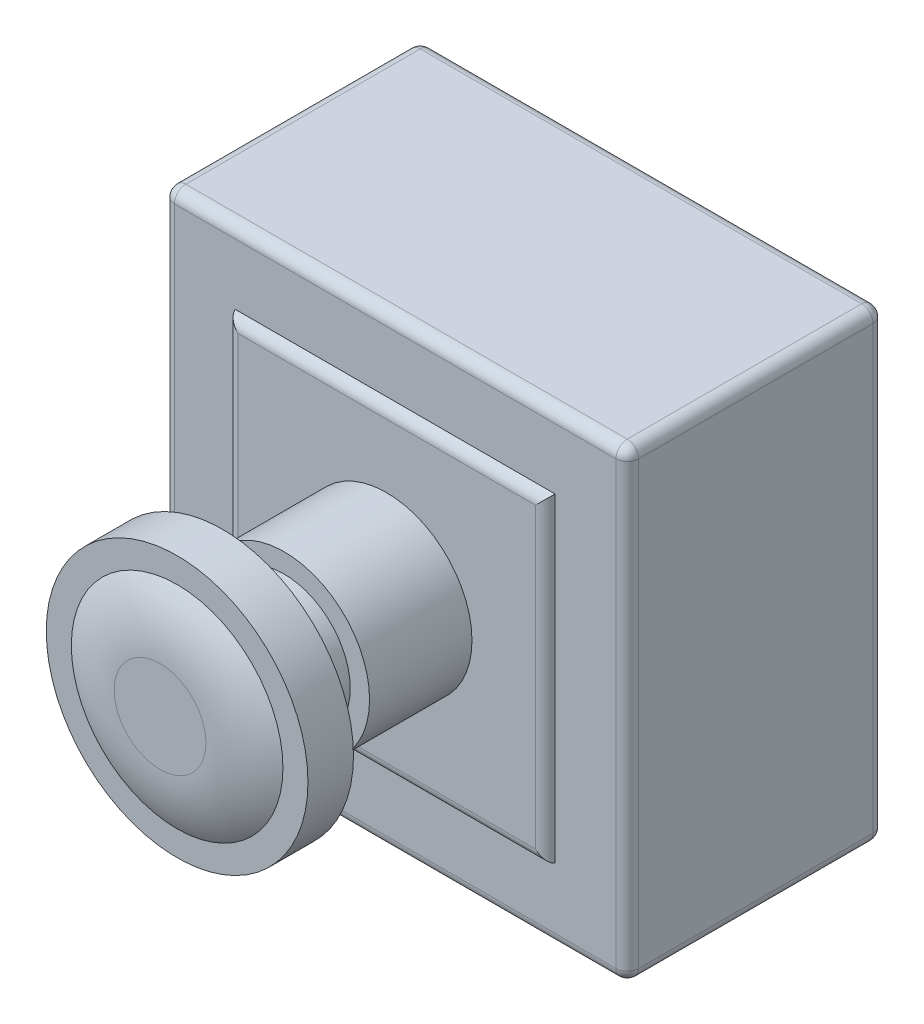
from build123d import *

# Parameters (mm, degrees)
CROQUIS1_W              = 40.8
CROQUIS1_H              = 40.8
SALIENTE_EXTRUIR1_DEPTH = 11.3
CROQUIS2_W              = 28.1
CROQUIS2_H              = 28.1
SALIENTE_EXTRUIR2_DEPTH = 0.75
REDONDEO1_R             = 1
CROQUIS3_R              = 7.5
SALIENTE_EXTRUIR3_DEPTH = 9
CROQUIS4_R              = 5.8
SALIENTE_EXTRUIR4_DEPTH = 7
CROQUIS5_R              = 11.5
SALIENTE_EXTRUIR5_DEPTH = 2
CROQUIS6_R              = 9.3
SALIENTE_EXTRUIR6_DEPTH = 1.5
REDONDEO4_R             = 10
CROQUIS7_R              = 2.5
SALIENTE_EXTRUIR7_DEPTH = 5
REDONDEO5_R             = 1


with BuildPart() as part:
    # Croquis1 → Saliente-Extruir1 (new, symmetric)
    with BuildSketch(Plane.XY):
        Rectangle(CROQUIS1_W, CROQUIS1_H)
    extrude(amount=SALIENTE_EXTRUIR1_DEPTH, both=True)

    # Croquis2 → Saliente-Extruir2 (add, symmetric)
    with BuildSketch(Plane.XY.offset(11.3)):
        Rectangle(CROQUIS2_W, CROQUIS2_H)
    extrude(amount=SALIENTE_EXTRUIR2_DEPTH, both=True)

    # Redondeo1
    # the kernel refuses this fillet: 1 mm, written as the material it takes off along each edge
    with BuildSketch(Plane(origin=(14.05, 16.470614591, 12.05), x_dir=(0, 0, -1), z_dir=(0, -1, 0)), Plane(origin=(-16.470614591, 14.05, 12.05), x_dir=(0, 0, -1), z_dir=(1, 0, 0)), Plane(origin=(16.470614591, -14.05, 12.05), x_dir=(0, 0, -1), z_dir=(-1, 0, 0)), Plane(origin=(-14.05, -16.470614591, 12.05), x_dir=(0, 0, -1), z_dir=(0, 1, 0))) as redondeo1_piece_1:
        with BuildLine():
            CenterArc((1, -0.968245837), REDONDEO1_R, 104.477512186, 75.522487814)
            Line((0, -0.968245837), (-0.02, -0.968245837))
            Line((-0.02, -0.968245837), (-0.02, 0))
            Line((-0.02, 0), (0, 0.02))
            ThreePointArc((0, 0.02), (0.375, 0.02), (0.745, 0.019364917))
            Line((0.745, 0.019364917), (0.75, 0))
        make_face()
    extrude(amount=32.941229183, mode=Mode.SUBTRACT)

    # Croquis3 → Saliente-Extruir3 (add)
    with BuildSketch(Plane.XY.offset(12.05)):
        Circle(CROQUIS3_R)
    extrude(amount=SALIENTE_EXTRUIR3_DEPTH)

    # Croquis4 → Saliente-Extruir4 (add)
    with BuildSketch(Plane.XY.offset(21.05)):
        Circle(CROQUIS4_R)
    extrude(amount=SALIENTE_EXTRUIR4_DEPTH)

    # Croquis5 → Saliente-Extruir5 (add, symmetric)
    with BuildSketch(Plane.XY.offset(28.05)):
        with Locations((-0.414239482, 0)):
            Circle(CROQUIS5_R)
    extrude(amount=SALIENTE_EXTRUIR5_DEPTH, both=True)

    # Croquis6 → Saliente-Extruir6 (add, symmetric)
    with BuildSketch(Plane.XY.offset(30.05)):
        with Locations((-0.414239482, 0)):
            Circle(CROQUIS6_R)
    extrude(amount=SALIENTE_EXTRUIR6_DEPTH, both=True)

    # Redondeo4
    # the kernel refuses this fillet: 10 mm, written as the material it takes off along each edge
    with BuildSketch(Plane(origin=(-0.414239482, 0, 31.55), x_dir=(1, 0, 0), z_dir=(0, -1, 0))) as redondeo4_piece_1:
        with BuildLine():
            CenterArc((4.032173124, -10), REDONDEO4_R, 58.211669383, 31.788330617)
            Line((4.032173124, 0), (4.032173124, 0.2))
            Line((4.032173124, 0.2), (9.3, 0.2))
            Line((9.3, 0.2), (9.5, 0))
            ThreePointArc((9.5, 0), (9.5, -0.75), (9.405356538, -1.33))
            Line((9.405356538, -1.33), (9.3, -1.5))
        make_face()
    revolve(axis=Axis((-0.414239482, 0, 31.55), (0, 0, 1)), mode=Mode.SUBTRACT)

    # Croquis7 → Saliente-Extruir7 (add)
    with BuildSketch(Plane(origin=(0, 0, -11.3), x_dir=(-1, 0, 0), z_dir=(0, 0, -1))):
        with Locations(Location((-9.4, 11.9, 0), (0, 0, 180))):
            Circle(CROQUIS7_R)
    extrude(amount=SALIENTE_EXTRUIR7_DEPTH)

    # Redondeo5
    redondeo5_edges = [part.edges().sort_by_distance(p)[0] for p in [
        (-20.4, 0, 11.3),
        (0, -20.4, 11.3),
        (20.4, 0, 11.3),
        (0, -20.4, -11.3),
        (-20.4, 0, -11.3),
        (0, 20.4, -11.3),
        (20.4, 0, -11.3),
        (20.4, -20.4, 0),
        (-20.4, -20.4, 0),
        (-20.4, 20.4, 0),
        (20.4, 20.4, 0),
        (0, 20.4, 11.3),
    ]]
    fillet(redondeo5_edges, radius=REDONDEO5_R)


solid = part.part
